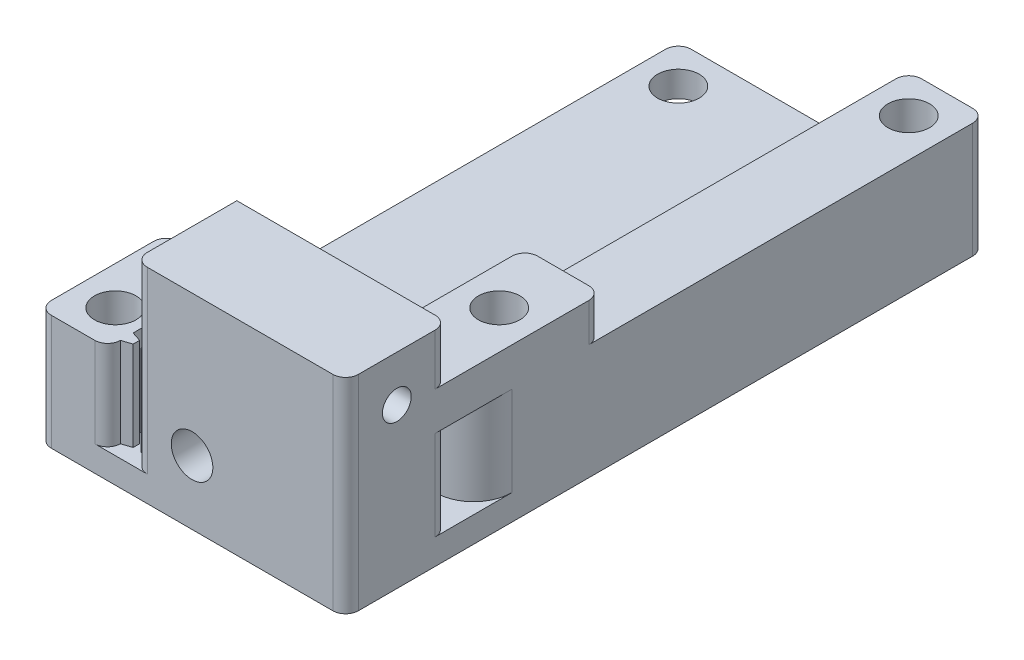
from build123d import *

# Parameters (mm, degrees)
SKETCH1_W           = 24
SKETCH1_H           = 50
BOSS_EXTRUDE1_DEPTH = 2
SKETCH2_W           = 6
SKETCH2_H           = 40
SKETCH2_W_2         = 9
SKETCH2_H_2         = 10
SKETCH2_W_3         = 5.4
BOSS_EXTRUDE2_DEPTH = 7
FILLET1_R           = 3
SKETCH3_W           = 16.5
SKETCH3_H           = 8
BOSS_EXTRUDE3_DEPTH = 14
SKETCH4_R           = 1.625
CUT_EXTRUDE1_DEPTH  = 45.72135955
CUT_EXTRUDE2_DEPTH  = 2
SKETCH9_W           = 6
SKETCH9_H           = 20
BOSS_EXTRUDE4_DEPTH = 3
SKETCH6_R           = 1.125
CUT_EXTRUDE3_DEPTH  = 39.170669368
SKETCH7_W           = 2
SKETCH7_H           = 40
CUT_EXTRUDE4_DEPTH  = 1
SKETCH8_R           = 1.625
CUT_EXTRUDE5_DEPTH  = 33.015621187
FILLET2_R           = 1
BOSS_EXTRUDE5_DEPTH = 7
LPATTERN1_COUNT     = 5
LPATTERN1_PITCH     = 2


with BuildPart() as part:
    # Sketch1 → Boss-Extrude1 (new body)
    with BuildSketch(Plane(origin=(0, 0, 0), x_dir=(1, 0, 0), z_dir=(0, 1, 0))):
        Rectangle(SKETCH1_W, SKETCH1_H)
    extrude(amount=BOSS_EXTRUDE1_DEPTH)

    # Sketch2 → Boss-Extrude2 (add)
    with BuildSketch(Plane(origin=(0, 2, 0), x_dir=(1, 0, 0), z_dir=(0, 1, 0))):
        with Locations((9, 5)):
            Rectangle(SKETCH2_W, SKETCH2_H)
        with Locations((0, -20)):
            Rectangle(SKETCH2_W_2, SKETCH2_H_2)
        with Locations((-9.3, -20)):
            Rectangle(SKETCH2_W_3, SKETCH2_H_2)
    extrude(amount=BOSS_EXTRUDE2_DEPTH)

    # Fillet1
    fillet1_edges = [part.edges().sort_by_distance(p)[0] for p in [
        (12, 5.5, 15),
        (6, 5.5, 15),
    ]]
    fillet(fillet1_edges, radius=FILLET1_R - 0.0001)  # a hair under: the kernel refuses the full size

    # Sketch3 → Boss-Extrude3 (add)
    with BuildSketch(Plane(origin=(0, 2, 0), x_dir=(1, 0, 0), z_dir=(0, 1, 0))):
        with Locations((3.75, -21)):
            Rectangle(SKETCH3_W, SKETCH3_H)
    extrude(amount=BOSS_EXTRUDE3_DEPTH)

    # Sketch4 → Cut-Extrude1 (cut, through all)
    with BuildSketch(Plane(origin=(0, 0, 15), x_dir=(-1, 0, 0), z_dir=(0, 0, -1))):
        with Locations((0, 5)):
            Circle(SKETCH4_R)
    extrude(amount=-CUT_EXTRUDE1_DEPTH, mode=Mode.SUBTRACT)

    # Sketch5 → Cut-Extrude2 (cut)
    with BuildSketch(Plane(origin=(0, 0, 15), x_dir=(-1, 0, 0), z_dir=(0, 0, -1))):
        Polygon((-2.875, 6.659882024), (-2.875, 9), (2.875, 9), (2.875, 6.659882024), (2.875, 3.340117976), (0, 1.680235952), (-2.875, 3.340117976), align=None)
    extrude(amount=-CUT_EXTRUDE2_DEPTH, mode=Mode.SUBTRACT)

    # Sketch9 → Boss-Extrude4 (add)
    with BuildSketch(Plane(origin=(0, 9, 0), x_dir=(1, 0, 0), z_dir=(0, 1, 0))):
        with Locations((9, -15)):
            Rectangle(SKETCH9_W, SKETCH9_H)
    extrude(amount=BOSS_EXTRUDE4_DEPTH)

    # Sketch6 → Cut-Extrude3 (cut, through all)
    with BuildSketch(Plane(origin=(12, 0, 0), x_dir=(0, 0, -1), z_dir=(1, 0, 0))):
        with Locations((-21, 12.43)):
            Circle(SKETCH6_R)
    extrude(amount=-CUT_EXTRUDE3_DEPTH, mode=Mode.SUBTRACT)

    # Sketch7 → Cut-Extrude4 (cut)
    with BuildSketch(Plane(origin=(0, 2, 0), x_dir=(1, 0, 0), z_dir=(0, 1, 0))):
        with Locations((0, 5)):
            Rectangle(SKETCH7_W, SKETCH7_H)
    extrude(amount=-CUT_EXTRUDE4_DEPTH, mode=Mode.SUBTRACT)

    # Sketch8 → Cut-Extrude5 (cut, through all)
    with BuildSketch(Plane.XZ):
        with Locations(Location((-9, 22, 0), (0, 0, 270))):
            Circle(SKETCH8_R)
        with Locations(Location((9, 10, 0), (0, 0, 270))):
            Circle(SKETCH8_R)
        with Locations(Location((9, -22, 0), (0, 0, 270))):
            Circle(SKETCH8_R)
        with Locations(Location((-9, -22, 0), (0, 0, 270))):
            Circle(SKETCH8_R)
    extrude(amount=-CUT_EXTRUDE5_DEPTH, mode=Mode.SUBTRACT)

    # Fillet2
    fillet2_edges = [part.edges().sort_by_distance(p)[0] for p in [
        (12, 5.5, 17),
        (6, 10.5, 5),
        (12, 10.5, 5),
        (6, 5.5, -25),
        (-4.5, 9, 25),
        (-12, 5.5, 15),
        (-6.6, 5.5, 25),
        (12, 14, 17),
        (-12, 1, -25),
        (12, 4.5, -25),
        (12, 8, 25),
        (-12, 4.5, 25),
    ]]
    fillet(fillet2_edges, radius=FILLET2_R)

    # Sketch10 → Boss-Extrude5 (add)
    with BuildSketch(Plane(origin=(0, 2, 0), x_dir=(1, 0, 0), z_dir=(0, 1, 0))):
        Polygon((-6.6, -24), (-6.6, -23), (-5.85, -23.25), (-5.85, -23.75), align=None)
        Polygon((-5.25, -23.75), (-4.5, -24), (-4.5, -23), (-5.25, -23.25), align=None)
    boss_extrude5 = extrude(amount=BOSS_EXTRUDE5_DEPTH)

    # LPattern1: Boss-Extrude5 ×5
    with Locations(*[(0, 0, -i * LPATTERN1_PITCH) for i in range(1, LPATTERN1_COUNT)]):
        add(boss_extrude5)


solid = part.part
